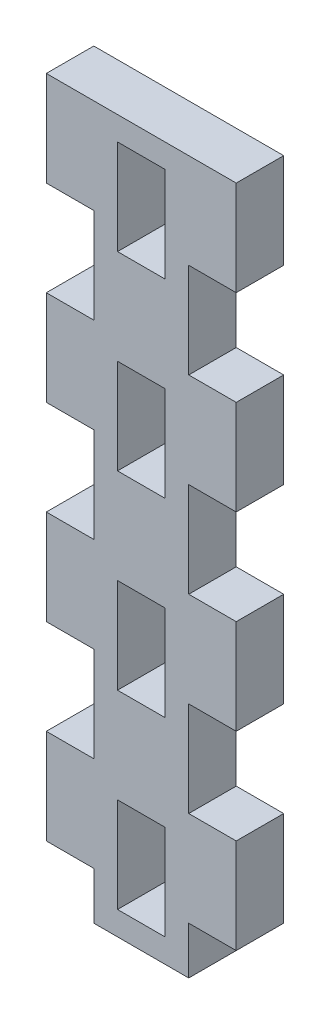
from build123d import *

# Parameters (mm, degrees)
SKETCH_1_W          = 20
SKETCH_1_H          = 75
EXTRUDE_1_DEPTH     = 5
SKETCH_2_W          = 5
SKETCH_2_H          = 10
CUT_EXTRUDE_1_DEPTH = 40.131189606
SKETCH_3_W          = 5
SKETCH_3_H          = 10
CUT_EXTRUDE_2_DEPTH = 40.131189606


with BuildPart() as part:
    # ｽｹｯﾁ1 → ﾎﾞｽ - 押し出し1 (new body)
    with BuildSketch(Plane.XY):
        Rectangle(SKETCH_1_W, SKETCH_1_H)
    extrude(amount=EXTRUDE_1_DEPTH)

    # ｽｹｯﾁ2 → ｶｯﾄ - 押し出し1 (cut, through all)
    with BuildSketch(Plane.XY.offset(5)):
        with Locations((-7.5, 22.5)):
            Rectangle(SKETCH_2_W, SKETCH_2_H)
        with Locations((-7.5, 2.5)):
            Rectangle(SKETCH_2_W, SKETCH_2_H)
        with Locations((-7.5, -17.5)):
            Rectangle(SKETCH_2_W, SKETCH_2_H)
        with Locations((-7.5, -37.5)):
            Rectangle(SKETCH_2_W, SKETCH_2_H)
        with Locations((7.5, -37.5)):
            Rectangle(SKETCH_2_W, SKETCH_2_H)
        with Locations((7.5, -17.5)):
            Rectangle(SKETCH_2_W, SKETCH_2_H)
        with Locations((7.5, 2.5)):
            Rectangle(SKETCH_2_W, SKETCH_2_H)
        with Locations((7.5, 22.5)):
            Rectangle(SKETCH_2_W, SKETCH_2_H)
    extrude(amount=-CUT_EXTRUDE_1_DEPTH, mode=Mode.SUBTRACT)

    # ｽｹｯﾁ3 → ｶｯﾄ - 押し出し2 (cut, through all)
    with BuildSketch(Plane.XY.offset(5)):
        with Locations((0, -30)):
            Rectangle(SKETCH_3_W, SKETCH_3_H)
        with Locations((0, -10)):
            Rectangle(SKETCH_3_W, SKETCH_3_H)
        with Locations((0, 10)):
            Rectangle(SKETCH_3_W, SKETCH_3_H)
        with Locations((0, 30)):
            Rectangle(SKETCH_3_W, SKETCH_3_H)
    extrude(amount=-CUT_EXTRUDE_2_DEPTH, mode=Mode.SUBTRACT)


solid = part.part
